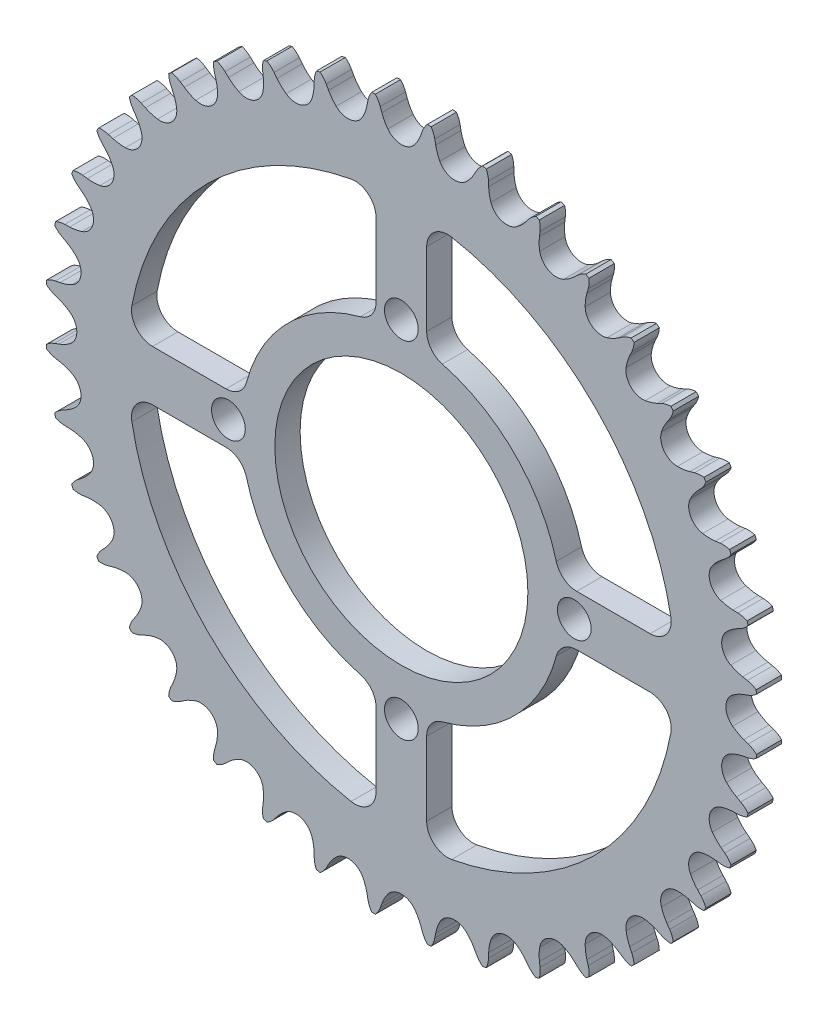
from build123d import *

# Parameters (mm, degrees)
ESQUISSE2_R                  = 76.944042254
BOSS_EXTRU_1_DEPTH           = 6
BOSS_EXTRU_2_START           = -6
BOSS_EXTRU_2_DEPTH           = 6
R_P_TITION_CIRCULAIRE1_COUNT = 40
ESQUISSE4_R                  = 30
ESQUISSE4_R_2                = 4
ENL_V_MAT_EXTRU_1_DEPTH      = 120.88032279
R_P_TITION_CIRCULAIRE2_COUNT = 4
ENL_V_MAT_EXTRU_2_DEPTH      = 120.88032279
R_P_TITION_CIRCULAIRE3_COUNT = 4
ESQUISSE6_R                  = 84.923742254
ESQUISSE6_R_2                = 84.423742254
ENL_V_MAT_EXTRU_3_DEPTH      = 120.88032279


with BuildPart() as part:
    # Esquisse2 → Boss.-Extru.1 (new body)
    with BuildSketch(Plane.XY):
        Circle(ESQUISSE2_R)
    extrude(amount=BOSS_EXTRU_1_DEPTH)

    # Esquisse3 → Boss.-Extru.2 (add)
    with BuildSketch(Plane.XY.offset(6).offset(BOSS_EXTRU_2_START)):
        with BuildLine():
            Line((-7.924828361, 82.031604434), (-8.139873238, 80.914892223))
            ThreePointArc((-8.139873238, 80.914892223), (-8.528544186, 79.469399399), (-9.121809966, 78.095154034))
            ThreePointArc((-9.121809966, 78.095154034), (-10.32978161, 76.699403287), (-12.036700088, 75.996733413))
            ThreePointArc((-12.036700088, 75.996733413), (-6.036959977, 76.706849451), (0, 76.944042254))
            ThreePointArc((0, 76.944042254), (-1.795825265, 77.371040217), (-3.207268295, 78.560638558))
            ThreePointArc((-3.207268295, 78.560638558), (-4.008209327, 79.825157468), (-4.618219988, 81.192052344))
            Line((-4.618219988, 81.192052344), (-5.005309583, 82.261375545))
            ThreePointArc((-5.005309583, 82.261375545), (-5.679059654, 83.568778746), (-6.663040023, 84.661950699))
            ThreePointArc((-6.663040023, 84.661950699), (-7.463896192, 83.428309064), (-7.924828361, 82.031604434))
        make_face()
    boss_extru_2 = extrude(amount=BOSS_EXTRU_2_DEPTH)

    # Répétition circulaire1: Boss.-Extru.2 ×40 about axis
    r_p_tition_circulaire1_axis = Axis((0, 0, 0), (0, 0, 1))
    for i in range(1, R_P_TITION_CIRCULAIRE1_COUNT):
        add(boss_extru_2.rotate(r_p_tition_circulaire1_axis, i * 360 / R_P_TITION_CIRCULAIRE1_COUNT))

    # Esquisse4 → Enlèv. mat.-Extru.1 (cut, through all)
    with BuildSketch(Plane.XY.offset(6)):
        Circle(ESQUISSE4_R)
        with Locations((0, 41)):
            Circle(ESQUISSE4_R_2)
    enl_v_mat_extru_1 = extrude(amount=-ENL_V_MAT_EXTRU_1_DEPTH, mode=Mode.SUBTRACT)

    # Répétition circulaire2: Enlèv. mat.-Extru.1 ×4 about axis
    r_p_tition_circulaire2_axis = Axis((0, 0, 0), (0, 0, 1))
    for i in range(1, R_P_TITION_CIRCULAIRE2_COUNT):
        add(enl_v_mat_extru_1.rotate(r_p_tition_circulaire2_axis, i * 360 / R_P_TITION_CIRCULAIRE2_COUNT), mode=Mode.SUBTRACT)

    # Esquisse5 → Enlèv. mat.-Extru.2 (cut, through all)
    with BuildSketch(Plane(origin=(0, 0, 0), x_dir=(-1, 0, 0), z_dir=(0, 0, -1))):
        with BuildLine():
            Line((6, 41.569219382), (6, 58.983048412))
            ThreePointArc((6, 58.983048412), (7.804951748, 62.829041999), (11.916666667, 63.898302447))
            ThreePointArc((11.916666667, 63.898302447), (45.961940777, 45.961940777), (63.898302447, 11.916666667))
            ThreePointArc((63.898302447, 11.916666667), (62.829041999, 7.804951748), (58.983048412, 6))
            Line((58.983048412, 6), (41.569219382, 6))
            ThreePointArc((41.569219382, 6), (38.519247975, 7.037970922), (36.735589221, 9.720930233))
            ThreePointArc((36.735589221, 9.720930233), (26.870057685, 26.870057685), (9.720930233, 36.735589221))
            ThreePointArc((9.720930233, 36.735589221), (7.037970922, 38.519247975), (6, 41.569219382))
        make_face()
    enl_v_mat_extru_2 = extrude(amount=-ENL_V_MAT_EXTRU_2_DEPTH, mode=Mode.SUBTRACT)

    # Répétition circulaire3: Enlèv. mat.-Extru.2 ×4 about axis
    r_p_tition_circulaire3_axis = Axis((0, 0, 0), (0, 0, 1))
    for i in range(1, R_P_TITION_CIRCULAIRE3_COUNT):
        add(enl_v_mat_extru_2.rotate(r_p_tition_circulaire3_axis, i * 360 / R_P_TITION_CIRCULAIRE3_COUNT), mode=Mode.SUBTRACT)

    # Esquisse6 → Enlèv. mat.-Extru.3 (cut, through all)
    with BuildSketch(Plane(origin=(0, 0, 0), x_dir=(-1, 0, 0), z_dir=(0, 0, -1))):
        Circle(ESQUISSE6_R)
        Circle(ESQUISSE6_R_2, mode=Mode.SUBTRACT)
    extrude(amount=-ENL_V_MAT_EXTRU_3_DEPTH, mode=Mode.SUBTRACT)


solid = part.part
